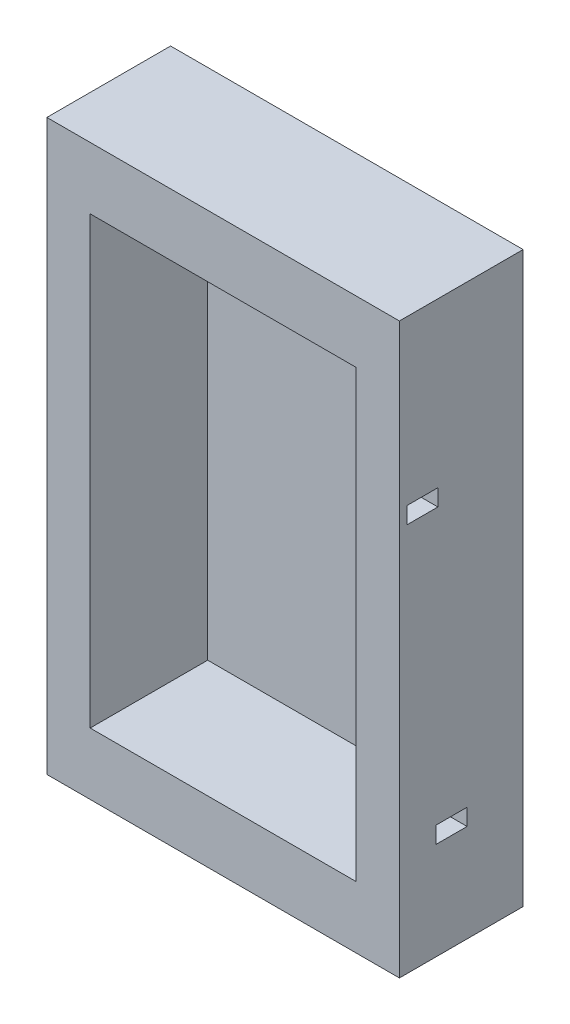
from build123d import *

# Parameters (mm, degrees)
SKETCH1_W           = 144.78
SKETCH1_H           = 233.68
BOSS_EXTRUDE1_DEPTH = 50.8
SKETCH2_W           = 109.22
SKETCH2_H           = 182.88
CUT_EXTRUDE1_DEPTH  = 48.26
CUT_EXTRUDE3_REACH  = 194.856
SKETCH6_W           = 12.7
SKETCH6_H           = 6.85


with BuildPart() as part:
    # Sketch1 → Boss-Extrude1 (new body)
    with BuildSketch(Plane.XY):
        Rectangle(SKETCH1_W, SKETCH1_H)
    extrude(amount=BOSS_EXTRUDE1_DEPTH)

    # Sketch2 → Cut-Extrude1 (cut)
    with BuildSketch(Plane.XY.offset(50.8)):
        Rectangle(SKETCH2_W, SKETCH2_H)
    extrude(amount=-CUT_EXTRUDE1_DEPTH, mode=Mode.SUBTRACT)

    # Sketch6 → Cut-Extrude3 (cut, up to next)
    with BuildSketch(Plane(origin=(72.39, 0, 0), x_dir=(0, 0, -1), z_dir=(1, 0, 0)), mode=Mode.PRIVATE) as cut_extrude3_sk1:
        with Locations((-41.35, 46.215)):
            Rectangle(SKETCH6_W, SKETCH6_H)
    cut_extrude3_tool1 = extrude(cut_extrude3_sk1.sketch, amount=-CUT_EXTRUDE3_REACH, mode=Mode.PRIVATE) & part.part
    # Sketch6 → Cut-Extrude3 (cut, up to next)
    with BuildSketch(Plane(origin=(72.39, 0, 0), x_dir=(0, 0, -1), z_dir=(1, 0, 0)), mode=Mode.PRIVATE) as cut_extrude3_sk2:
        with Locations((-29.35, -73.415)):
            Rectangle(SKETCH6_W, SKETCH6_H)
    cut_extrude3_tool2 = extrude(cut_extrude3_sk2.sketch, amount=-CUT_EXTRUDE3_REACH, mode=Mode.PRIVATE) & part.part
    add(cut_extrude3_tool1.solids().sort_by_distance((72.39, 46.215, 41.35))[0], mode=Mode.SUBTRACT)
    add(cut_extrude3_tool2.solids().sort_by_distance((72.39, -73.415, 29.35))[0], mode=Mode.SUBTRACT)


solid = part.part
